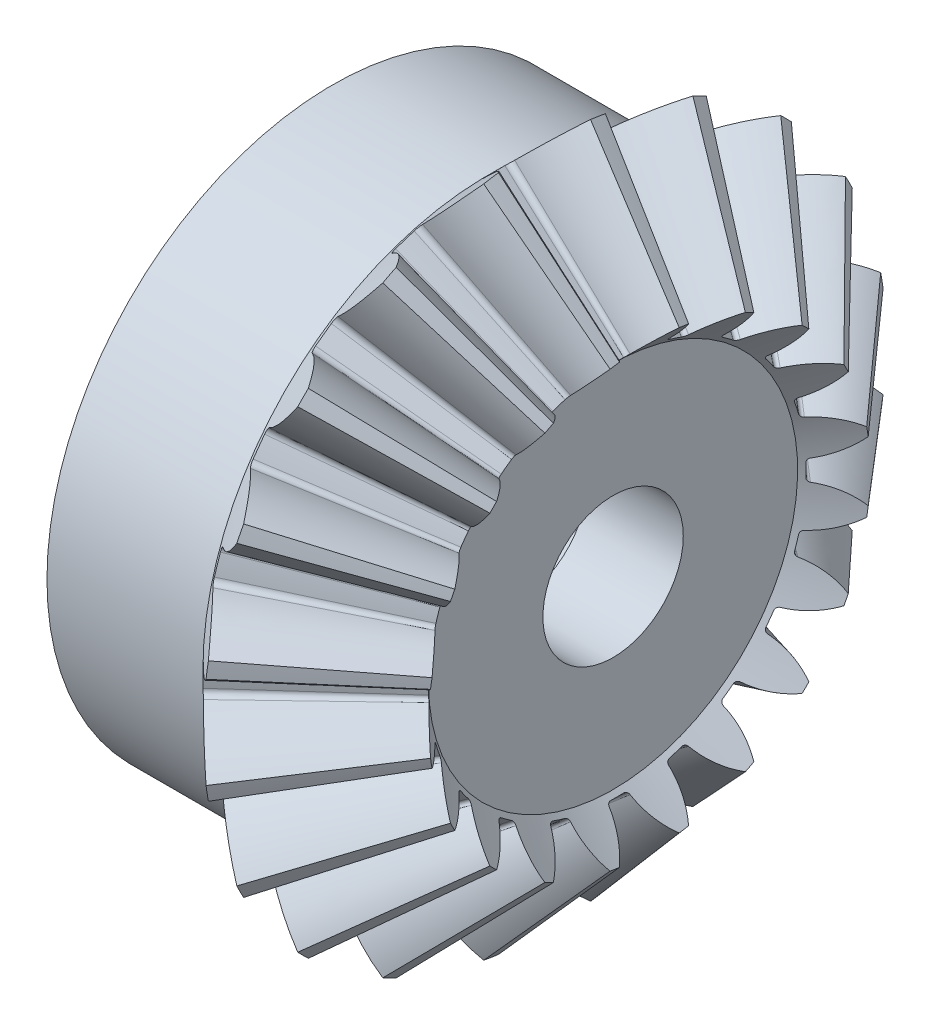
from build123d import *

# Parameters (mm, degrees)
TEETHCUTS_COUNT     = 20
TEETHCUTS_ANGLE     = 342
HUBSKE_R            = 4
HUB_DEPTH           = 2.444190931
BORSKE_R            = 2.5
BORE_DEPTH          = 7.9700508
SKETCH1_R           = 2.892259877
SKETCH1_R_2         = 1.1
BOSS_EXTRUDE2_DEPTH = 1.5
BOSS_EXTRUDE3_START = -2.444190931
SKETCH2_R           = 4.474089332
SKETCH2_R_2         = 2.5
SKETCH2_R_3         = 1.1
BOSS_EXTRUDE3_DEPTH = 2.444190931
SKETCH3_R           = 2.6
SKETCH3_R_2         = 2.5
CUT_EXTRUDE1_DEPTH  = 2.897895383


with BuildPart() as part:
    # BasProSke → Base-Revolve (revolve)
    with BuildSketch(Plane(origin=(0, 0, 0), x_dir=(1, 0, 0), z_dir=(0, 1, 0)), mode=Mode.PRIVATE) as base_revolve_sk:
        Polygon((0, 0), (0, 4.474089332), (0.87946406, 5.35355339), (2.522231011, 3.460786436), (1.953704452, 2.892259877), (1.953704452, 0), align=None)
    revolve(base_revolve_sk.sketch.rotate(Axis((-10, 0, 0), (1, 0, 0)), 180), axis=Axis((-10, 0, 0), (1, 0, 0)))

    # ToothCut: read off the stored shape, not the designer's step
    # ToothCut: loft between two sections, ruled curve by curve
    toothcut_from = [
        Edge.make_bspline([(5.531952177, 0.006041508, -0.00939629), (5.527732384, 0.001821715, -0.014822672), (5.522057014, -0.003853655, -0.014023113), (5.518677121, -0.007233548, -0.007526068)], [0, 0, 0, 0, 1, 1, 1, 1], 3, [1, 0.779688158, 0.779688158, 1]),
        Edge.make_bspline([(5.518677121, -0.007233548, 0.007526068), (5.522057014, -0.003853655, 0.014023113), (5.527732384, 0.001821715, 0.014822672), (5.531952177, 0.006041508, 0.00939629)], [0, 0, 0, 0, 1, 1, 1, 1], 3, [1, 0.779688158, 0.779688158, 1]),
        Edge.make_bspline([(5.518677121, -0.007233548, -0.007526068), (5.518172328, -0.007738341, -0.006555724), (5.517769574, -0.008141095, -0.005494225), (5.517476945, -0.008433724, -0.004362882)], [0, 0, 0, 0, 1, 1, 1, 1], 3, [1, 0.993308328, 0.993308328, 1]),
        Edge.make_bspline([(5.517476945, -0.008433724, 0.004362882), (5.517769574, -0.008141095, 0.005494225), (5.518172328, -0.007738341, 0.006555724), (5.518677121, -0.007233548, 0.007526068)], [0, 0, 0, 0, 1, 1, 1, 1], 3, [1, 0.993308328, 0.993308328, 1]),
        Edge.make_bspline([(5.517476945, -0.008433724, -0.004362882), (5.516740525, -0.009170144, -0.001515795), (5.516740525, -0.009170144, 0.001515795), (5.517476945, -0.008433724, 0.004362882)], [0, 0, 0, 0, 1, 1, 1, 1], 3, [1, 0.959426823, 0.959426823, 1]),
        Edge.make_line((5.531952177, 0.006041508, 0.00939629), (5.531952177, 0.006041508, -0.00939629)),
    ]
    toothcut_to = [
        Edge.make_bspline([(0.916293029, 5.390382359, -0.804029197), (0.708519064, 5.182608394, -0.511267893), (0.448006964, 4.922096295, -0.320700021), (0.158992745, 4.633082077, -0.25005453)], [0, 0, 0, 0, 1, 1, 1, 1], 3, [1, 0.968989264, 0.968989264, 1]),
        Edge.make_bspline([(0.158992745, 4.633082077, 0.25005453), (0.448006964, 4.922096295, 0.320700021), (0.708519064, 5.182608394, 0.511267893), (0.916293029, 5.390382359, 0.804029197)], [0, 0, 0, 0, 1, 1, 1, 1], 3, [1, 0.968989264, 0.968989264, 1]),
        Edge.make_bspline([(0.158992745, 4.633082077, -0.25005453), (0.124287502, 4.598376834, -0.241571318), (0.102074861, 4.576164193, -0.20291812), (0.103299279, 4.57738861, -0.153139869)], [0, 0, 0, 0, 1, 1, 1, 1], 3, [1, 0.835762325, 0.835762325, 1]),
        Edge.make_bspline([(0.103299279, 4.57738861, 0.153139869), (0.102074861, 4.576164193, 0.20291812), (0.124287502, 4.598376834, 0.241571318), (0.158992745, 4.633082077, 0.25005453)], [0, 0, 0, 0, 1, 1, 1, 1], 3, [1, 0.835762325, 0.835762325, 1]),
        Edge.make_bspline([(0.103299279, 4.57738861, -0.153139869), (0.105810005, 4.579899337, -0.051067203), (0.105810005, 4.579899337, 0.051067203), (0.103299279, 4.57738861, 0.153139869)], [0, 0, 0, 0, 1, 1, 1, 1], 3, [1, 0.99959701, 0.99959701, 1]),
        Edge.make_line((0.916293029, 5.390382359, 0.804029197), (0.916293029, 5.390382359, -0.804029197)),
    ]
    toothcut = Solid(Shell([*[Face.make_surface_from_curves(toothcut_from[k], toothcut_to[k]) for k in range(6)], Face(Wire(toothcut_from)), Face(Wire(toothcut_to))]))
    add(toothcut, mode=Mode.SUBTRACT)

    # TeethCuts: ToothCut ×20 about axis
    teethcuts_axis = Axis((-10, 0, 0), (1, 0, 0))
    for i in range(1, TEETHCUTS_COUNT):
        add(toothcut.rotate(teethcuts_axis, i * TEETHCUTS_ANGLE / (TEETHCUTS_COUNT - 1)), mode=Mode.SUBTRACT)

    # HubSke → Hub (add)
    with BuildSketch(Plane.ZY):
        with Locations(Location((0, 0, 0), (0, 0, 180))):
            Circle(HUBSKE_R)
    extrude(amount=HUB_DEPTH)

    # BorSke → Bore (cut, symmetric)
    with BuildSketch(Plane(origin=(0, 0, 0), x_dir=(0, 0, -1), z_dir=(1, 0, 0))):
        with Locations(Location((0, 0, 0), (0, 0, 180))):
            Circle(BORSKE_R)
    extrude(amount=BORE_DEPTH, both=True, mode=Mode.SUBTRACT)

    # Sketch1 → Boss-Extrude2 (add)
    with BuildSketch(Plane(origin=(1.953704452, 0, 0), x_dir=(0, 0, -1), z_dir=(1, 0, 0))):
        Circle(SKETCH1_R)
        Circle(SKETCH1_R_2, mode=Mode.SUBTRACT)
    extrude(amount=-BOSS_EXTRUDE2_DEPTH)

    # Sketch2 → Boss-Extrude3 (add)
    # profile 1 of 2: a face of its own
    with BuildSketch(Plane.ZY.offset(2.444190931).offset(BOSS_EXTRUDE3_START)):
        Circle(SKETCH2_R)
        Circle(SKETCH2_R_2, mode=Mode.SUBTRACT)
    # profile 2 of 2: a face of its own
    with BuildSketch(Plane.ZY.offset(2.444190931).offset(BOSS_EXTRUDE3_START)):
        with Locations(Location((0, 0, 0), (0, 0, 180))):
            Circle(SKETCH2_R_3)
    extrude(amount=BOSS_EXTRUDE3_DEPTH)


with BuildPart() as boss_extrude3_kept_piece:
    # of the separate pieces the step leaves, the one the design keeps (boss_extrude3_pieces_kept)
    add(part.part.solids().sort_by_distance((0, 0, 4.474089332))[0])

    # Sketch3 → Cut-Extrude1 (cut)
    with BuildSketch(Plane.ZY.offset(2.444190931)):
        Circle(SKETCH3_R)
        Circle(SKETCH3_R_2, mode=Mode.SUBTRACT)
    extrude(amount=-CUT_EXTRUDE1_DEPTH, mode=Mode.SUBTRACT)


solid = boss_extrude3_kept_piece.part
